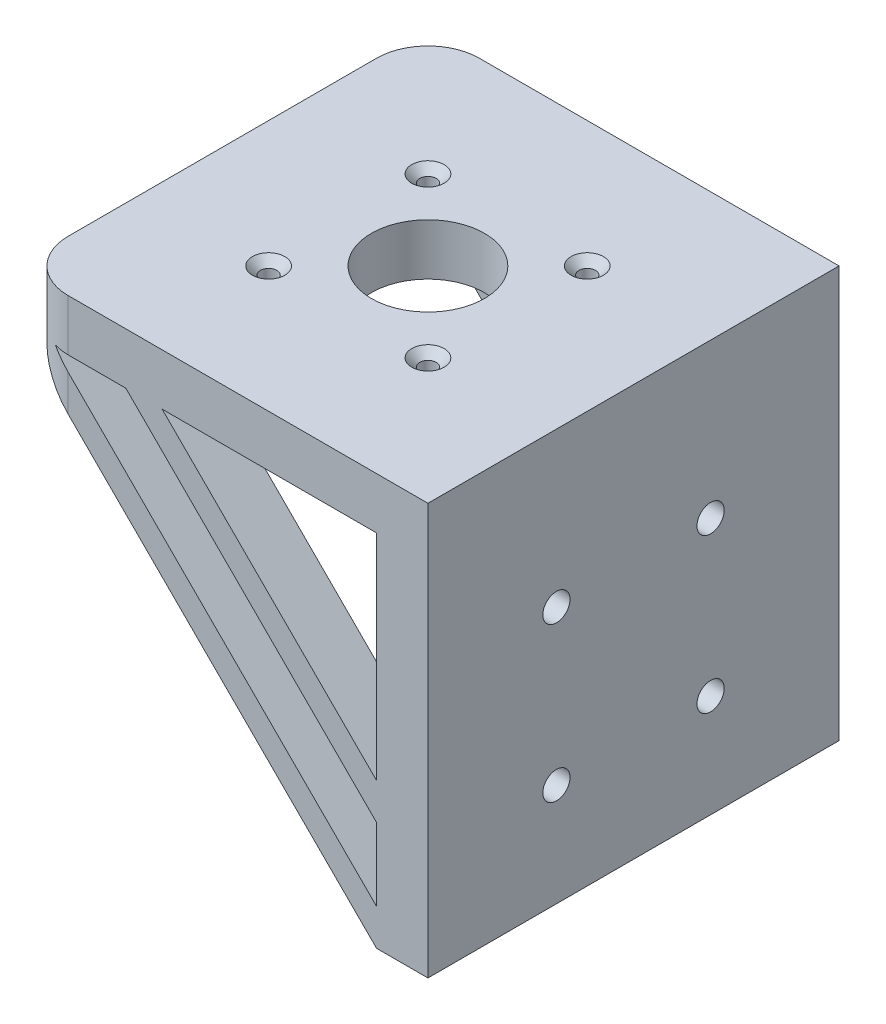
from build123d import *

# Parameters (mm, degrees)
SKETCH1_W                                           = 80
SKETCH1_H                                           = 80
SKETCH1_R                                           = 11
BOSS_EXTRUDE1_DEPTH                                 = 10
CSK_FOR_M3_COUNTERSUNK_FLAT_HEAD_SCREW1_D           = 3.2
CSK_FOR_M3_COUNTERSUNK_FLAT_HEAD_SCREW1_CSINK_D     = 6.3
CSK_FOR_M3_COUNTERSUNK_FLAT_HEAD_SCREW1_CSINK_ANGLE = 90
SKETCH5_W                                           = 10
SKETCH5_H                                           = 80
BOSS_EXTRUDE2_DEPTH                                 = 70
BOSS_EXTRUDE3_DEPTH                                 = 10
CSK_FOR_M5_COUNTERSUNK_FLAT_HEAD_SCREW1_D           = 5.3
CSK_FOR_M5_COUNTERSUNK_FLAT_HEAD_SCREW1_CSINK_D     = 10.4
CSK_FOR_M5_COUNTERSUNK_FLAT_HEAD_SCREW1_CSINK_ANGLE = 90
FILLET1_R                                           = 10


with BuildPart() as part:
    # Sketch1 → Boss-Extrude1 (new body)
    with BuildSketch(Plane(origin=(0, 0, 0), x_dir=(1, 0, 0), z_dir=(0, 1, 0))):
        Rectangle(SKETCH1_W, SKETCH1_H)
        with Locations(Location((0, 0, 0), (0, 0, 270))):
            Circle(SKETCH1_R, mode=Mode.SUBTRACT)
    extrude(amount=BOSS_EXTRUDE1_DEPTH)

    # CSK for M3 Countersunk Flat Head Screw1 (through all)
    with Locations(Plane(origin=(0, 10, 0), x_dir=(1, 0, 0), z_dir=(0, 1, 0))):
        with Locations((-15.5, 15.5), (15.5, 15.5), (15.5, -15.5), (-15.5, -15.5)):
            CounterSinkHole(CSK_FOR_M3_COUNTERSUNK_FLAT_HEAD_SCREW1_D / 2, CSK_FOR_M3_COUNTERSUNK_FLAT_HEAD_SCREW1_CSINK_D / 2, counter_sink_angle=CSK_FOR_M3_COUNTERSUNK_FLAT_HEAD_SCREW1_CSINK_ANGLE)

    # Sketch5 → Boss-Extrude2 (add)
    with BuildSketch(Plane(origin=(0, 0, 0), x_dir=(-1, 0, 0), z_dir=(0, -1, 0))):
        with Locations((-35, 0)):
            Rectangle(SKETCH5_W, SKETCH5_H)
    extrude(amount=BOSS_EXTRUDE2_DEPTH)

    # Sketch6 → Boss-Extrude3 (add)
    with BuildSketch(Plane.XY.offset(40)):
        Polygon((-11.715728753, 0), (-18.786796564, 0), (-15.251262658, -3.535533906), (26.464466094, -45.251262658), (30, -48.786796564), (30, -41.715728753), align=None)
        Polygon((-32.928932188, 0), (-40, 0), (30, -70), (30, -62.928932188), align=None)
    boss_extrude3 = extrude(amount=-BOSS_EXTRUDE3_DEPTH)

    # Mirror1: Boss-Extrude3 across plane
    add(boss_extrude3.mirror(Plane.XY))

    # CSK for M5 Countersunk Flat Head Screw1 (through all)
    with Locations(Plane.ZY.offset(-30)):
        with Locations((15, -20), (15, -50), (-15, -50), (-15, -20)):
            CounterSinkHole(CSK_FOR_M5_COUNTERSUNK_FLAT_HEAD_SCREW1_D / 2, CSK_FOR_M5_COUNTERSUNK_FLAT_HEAD_SCREW1_CSINK_D / 2, counter_sink_angle=CSK_FOR_M5_COUNTERSUNK_FLAT_HEAD_SCREW1_CSINK_ANGLE)

    # Fillet1
    # the kernel refuses this fillet: 10 mm, written as the material it takes off along each edge
    with BuildSketch(Plane(origin=(-40, -25, -40), x_dir=(1, 0, 0), z_dir=(0, 1, 0))) as fillet1_piece_1:
        with BuildLine():
            CenterArc((FILLET1_R, -FILLET1_R), FILLET1_R, 90, 90)
            Line((0, -FILLET1_R), (0, 0))
            Line((0, 0), (FILLET1_R, 0))
        make_face()
    extrude(amount=60, mode=Mode.SUBTRACT)
    with BuildSketch(Plane(origin=(-40, -25, 40), x_dir=(1, 0, 0), z_dir=(0, 1, 0))) as fillet1_piece_2:
        with BuildLine():
            CenterArc((FILLET1_R, FILLET1_R), FILLET1_R, 180, 90)
            Line((0, FILLET1_R), (0, 0))
            Line((0, 0), (FILLET1_R, 0))
        make_face()
    extrude(amount=60, mode=Mode.SUBTRACT)


solid = part.part
